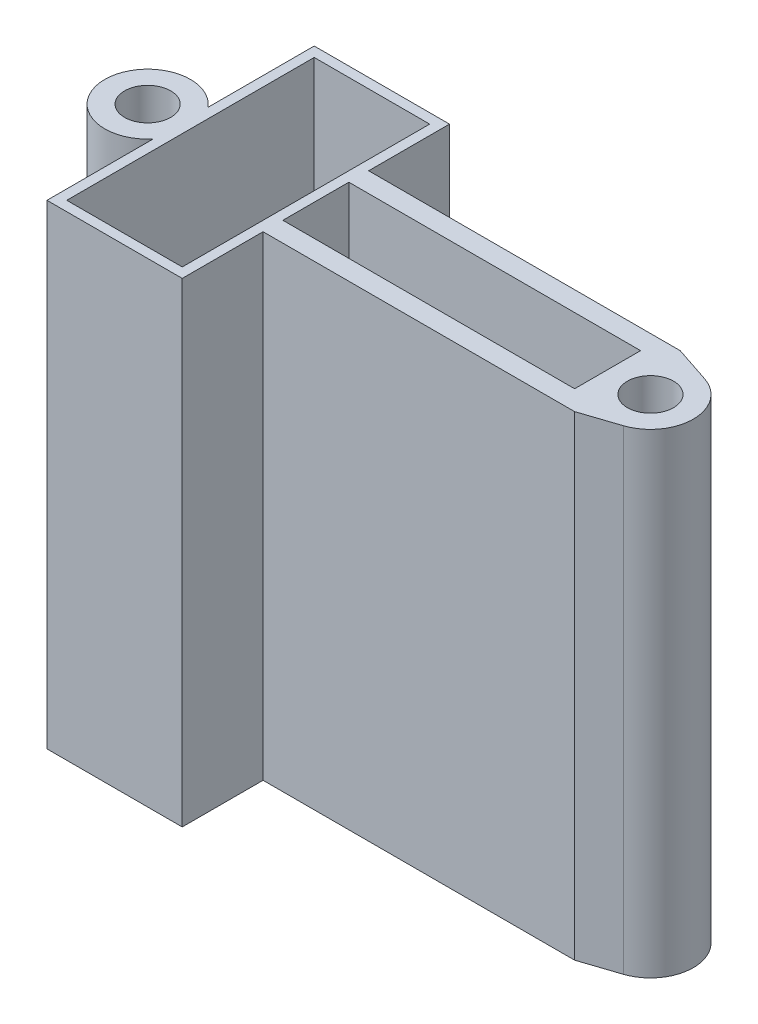
from build123d import *

# Parameters (mm, degrees)
SKETCH2_R           = 3.4925
SKETCH2_W           = 17.5
SKETCH2_H           = 37.5
SKETCH2_W_2         = 44.215
SKETCH2_H_2         = 10
BOSS_EXTRUDE2_DEPTH = 72


with BuildPart() as part:
    # Sketch2 → Boss-Extrude2 (new body)
    with BuildSketch(Plane(origin=(0, 0, 0), x_dir=(1, 0, 0), z_dir=(0, 1, 0))):
        with BuildLine():
            Line((-33.1075, 20.25), (-12.6075, 20.25))
            Line((-12.6075, 20.25), (-12.6075, 8))
            Line((-12.6075, 8), (34.6075, 8))
            Line((34.6075, 8), (40.145238744, 6.161944071))
            ThreePointArc((40.145238744, 6.161944071), (44.5925, 0), (40.145238744, -6.161944071))
            Line((40.145238744, -6.161944071), (34.6075, -8))
            Line((34.6075, -8), (-12.6075, -8))
            Line((-12.6075, -8), (-12.6075, -20.25))
            Line((-12.6075, -20.25), (-33.1075, -20.25))
            Line((-33.1075, -20.25), (-33.1075, -4.150602366))
            ThreePointArc((-33.1075, -4.150602366), (-44.5925, 0), (-33.1075, 4.150602366))
            Line((-33.1075, 4.150602366), (-33.1075, 20.25))
        make_face()
        with Locations((38.1, 0)):
            Circle(SKETCH2_R, mode=Mode.SUBTRACT)
        with Locations((-38.1, 0)):
            Circle(SKETCH2_R, mode=Mode.SUBTRACT)
        with Locations((-22.8575, 0)):
            Rectangle(SKETCH2_W, SKETCH2_H, mode=Mode.SUBTRACT)
        with Locations((9.5, 0)):
            Rectangle(SKETCH2_W_2, SKETCH2_H_2, mode=Mode.SUBTRACT)
    extrude(amount=BOSS_EXTRUDE2_DEPTH)


solid = part.part
